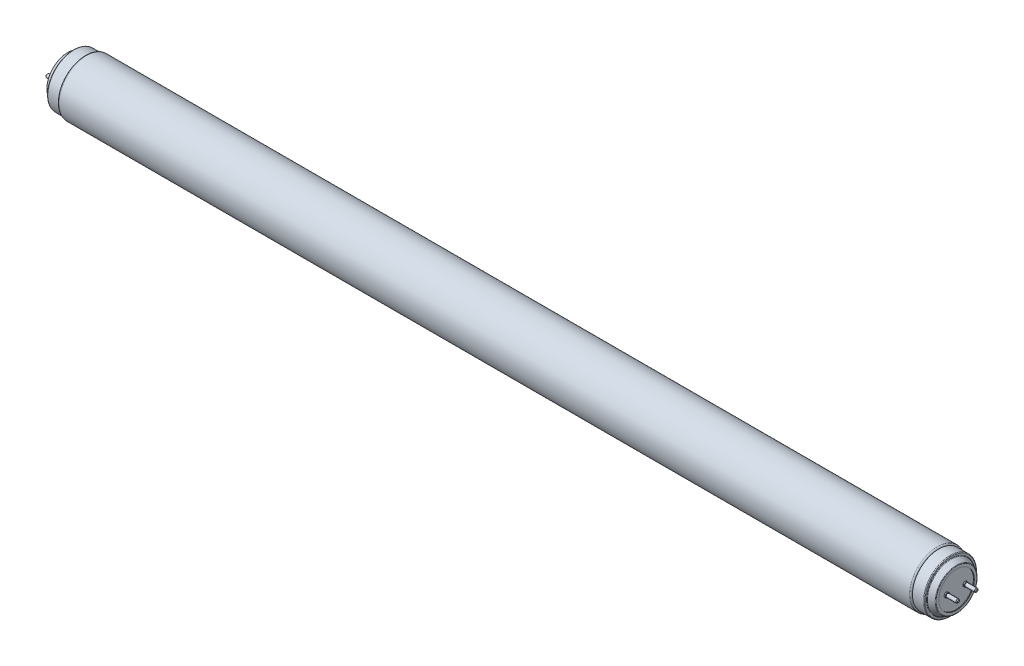
from build123d import *

# Parameters (mm, degrees)
SKETCH2_R      = 1.2
EXTRUDE1_DEPTH = 8
SKETCH3_R      = 1.5
EXTRUDE2_DEPTH = 1
EXTRUDE3_START = 8
SKETCH4_R      = 1.2
EXTRUDE3_DEPTH = 8
EXTRUDE4_START = 1
SKETCH5_R      = 1.5
EXTRUDE4_DEPTH = 1
CHAMFER1_SIZE  = 0.3
CHAMFER2_SIZE  = 0.5


with BuildPart() as part:
    # Sketch1 → Revolve1 (revolve)
    with BuildSketch(Plane.XY, mode=Mode.PRIVATE) as revolve1_sk:
        with BuildLine():
            Line((0, -17.75), (-7.5, -17.75))
            ThreePointArc((-7.5, -17.75), (-7.853553391, -17.603553391), (-8, -17.25))
            Line((-8, -17.25), (-8, -16.309016994))
            ThreePointArc((-8, -16.309016994), (-8.074674596, -16.046151438), (-8.276393202, -15.861803399))
            Line((-8.276393202, -15.861803399), (-11.723606798, -14.138196601))
            ThreePointArc((-11.723606798, -14.138196601), (-11.925325404, -13.953848562), (-12, -13.690983006))
            Line((-12, -13.690983006), (-12, -12))
            Line((-12, -12), (-11.5, -12))
            Line((-11.5, -12), (-11.5, 0))
            Line((-11.5, 0), (0, 0))
            Line((0, 0), (576, 0))
            Line((576, 0), (587.5, 0))
            Line((587.5, 0), (587.5, -12))
            Line((587.5, -12), (588, -12))
            Line((588, -12), (588, -13.690983006))
            ThreePointArc((588, -13.690983006), (587.925325404, -13.953848562), (587.723606798, -14.138196601))
            Line((587.723606798, -14.138196601), (584.276393202, -15.861803399))
            ThreePointArc((584.276393202, -15.861803399), (584.074674596, -16.046151438), (584, -16.309016994))
            Line((584, -16.309016994), (584, -17.25))
            ThreePointArc((584, -17.25), (583.853553391, -17.603553391), (583.5, -17.75))
            Line((583.5, -17.75), (576, -17.75))
            ThreePointArc((576, -17.75), (575.721751442, -18.421751442), (575.05, -18.7))
            Line((575.05, -18.7), (0.95, -18.7))
            ThreePointArc((0.95, -18.7), (0.278248558, -18.421751442), (0, -17.75))
        make_face()
    revolve(revolve1_sk.sketch.rotate(Axis((-11.5, 0, 0), (-1, 0, 0)), 270), axis=Axis((-11.5, 0, 0), (-1, 0, 0)))

    # Sketch2 → Extrude1 (add)
    with BuildSketch(Plane.ZY.offset(11.5)):
        with Locations(Location((-6.3, 0, 0), (0, 0, 180))):
            Circle(SKETCH2_R)
        with Locations(Location((6.3, 0, 0), (0, 0, 180))):
            Circle(SKETCH2_R)
    extrude(amount=EXTRUDE1_DEPTH)

    # Sketch3 → Extrude2 (add)
    with BuildSketch(Plane.ZY.offset(11.5)):
        with Locations(Location((-6.3, 0, 0), (0, 0, 180))):
            Circle(SKETCH3_R)
        with Locations(Location((6.3, 0, 0), (0, 0, 180))):
            Circle(SKETCH3_R)
    extrude(amount=EXTRUDE2_DEPTH)

    # Sketch4 → Extrude3 (add)
    with BuildSketch(Plane(origin=(587.5, 0, 0), x_dir=(0, 0, -1), z_dir=(1, 0, 0)).offset(EXTRUDE3_START)):
        with Locations(Location((6.3, 0, 0), (0, 0, 180))):
            Circle(SKETCH4_R)
        with Locations(Location((-6.3, 0, 0), (0, 0, 180))):
            Circle(SKETCH4_R)
    extrude(amount=-EXTRUDE3_DEPTH)

    # Sketch5 → Extrude4 (add)
    with BuildSketch(Plane(origin=(587.5, 0, 0), x_dir=(0, 0, -1), z_dir=(1, 0, 0)).offset(EXTRUDE4_START)):
        with Locations((6.3, 0)):
            Circle(SKETCH5_R)
        with Locations((-6.3, 0)):
            Circle(SKETCH5_R)
    extrude(amount=-EXTRUDE4_DEPTH)

    # Chamfer1
    chamfer1_edges = [part.edges().sort_by_distance(p)[0] for p in [
        (-12.5, 0, -4.8),
        (-12.5, 0, 7.8),
        (588.5, 0, -4.8),
        (588.5, 0, 7.8),
    ]]
    chamfer(chamfer1_edges, length=CHAMFER1_SIZE - 0.0001)  # a hair under: the kernel refuses the full size

    # Chamfer2
    chamfer2_edges = [part.edges().sort_by_distance(p)[0] for p in [
        (-19.5, 0, -5.1),
        (-19.5, 0, 7.5),
        (595.5, 0, -7.5),
        (595.5, 0, 5.1),
    ]]
    chamfer(chamfer2_edges, length=CHAMFER2_SIZE)


solid = part.part
